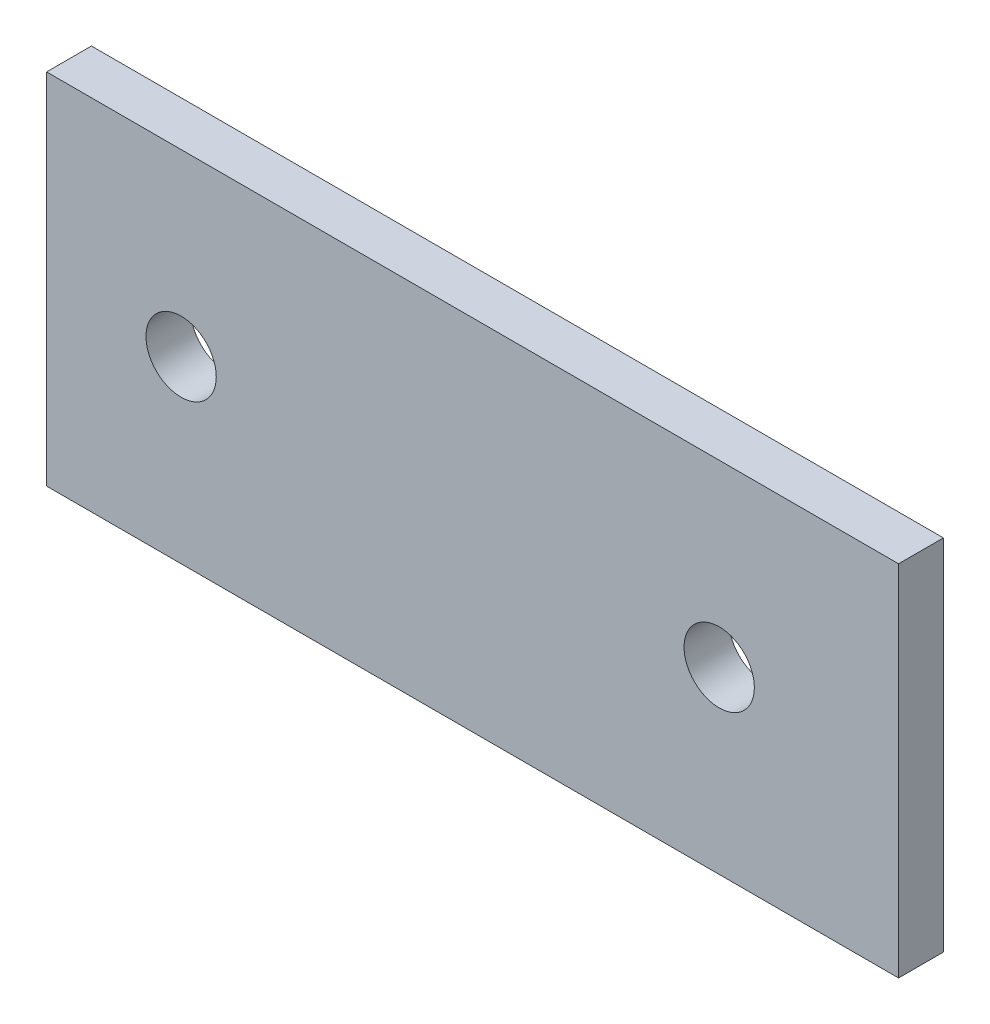
from build123d import *

# Parameters (mm, degrees)
SKETCH1_W           = 60.325
SKETCH1_H           = 25.4
SKETCH1_R           = 2.4892
BOSS_EXTRUDE1_DEPTH = 1.5875


with BuildPart() as part:
    # Sketch1 → Boss-Extrude1 (new, symmetric)
    with BuildSketch(Plane.XY):
        Rectangle(SKETCH1_W, SKETCH1_H)
        with Locations((-20.6375, 0)):
            Circle(SKETCH1_R, mode=Mode.SUBTRACT)
        with Locations((17.4625, 0)):
            Circle(SKETCH1_R, mode=Mode.SUBTRACT)
    extrude(amount=BOSS_EXTRUDE1_DEPTH, both=True)


solid = part.part
